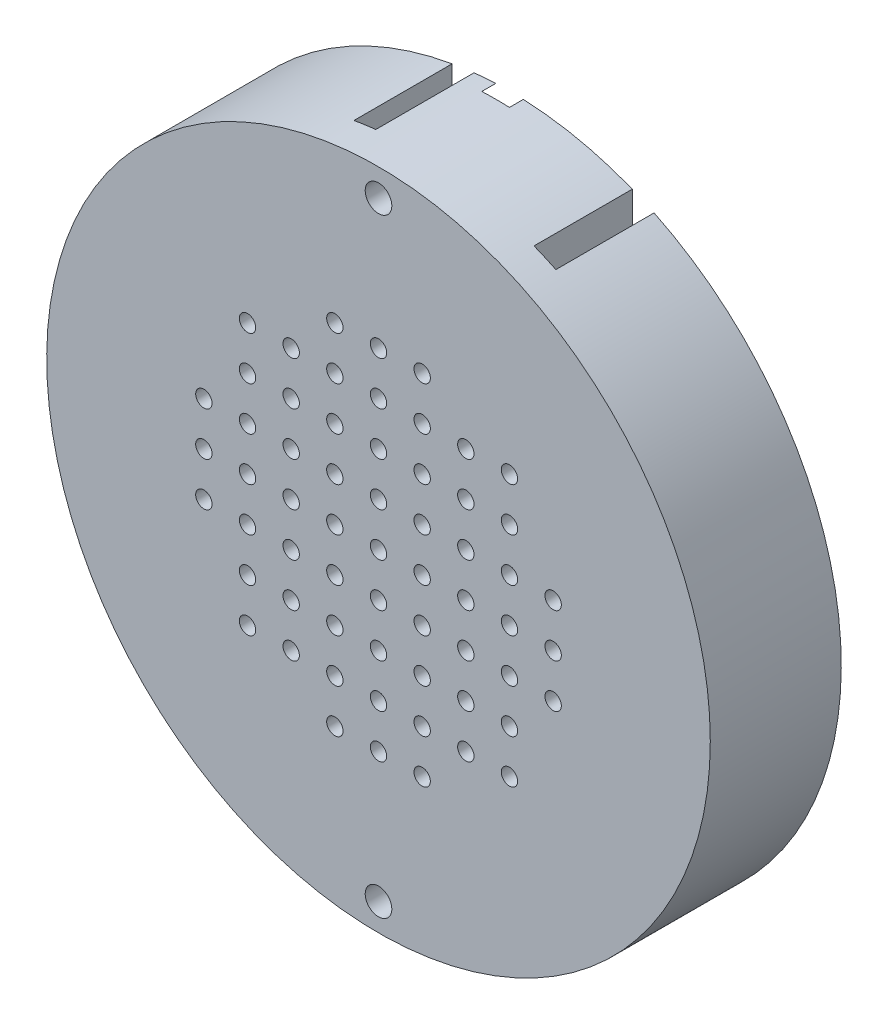
from build123d import *

# Parameters (mm, degrees)
SKETCH1_R                                           = 30.4
BOSS_EXTRUDE1_DEPTH                                 = 12
SKETCH2_R                                           = 0.75
CUT_EXTRUDE1_DEPTH                                  = 45.635411951
LPATTERN1_COUNT                                     = 5
LPATTERN1_PITCH                                     = 4
LPATTERN1_COUNT_DIR2                                = 5
LPATTERN1_PITCH_DIR2                                = 4
MIRROR1_COPY_1_SKETCH_R                             = 0.75
MIRROR1_COPY_1_DEPTH                                = 45.635411951
MIRROR1_COPY_2_SKETCH_R                             = 0.75
MIRROR1_COPY_2_DEPTH                                = 45.635411951
MIRROR1_COPY_3_SKETCH_R                             = 0.75
MIRROR1_COPY_3_DEPTH                                = 45.635411951
MIRROR1_COPY_4_SKETCH_R                             = 0.75
MIRROR1_COPY_4_DEPTH                                = 45.635411951
MIRROR1_COPY_5_SKETCH_R                             = 0.75
MIRROR1_COPY_5_DEPTH                                = 45.635411951
MIRROR1_COPY_6_SKETCH_R                             = 0.75
MIRROR1_COPY_6_DEPTH                                = 45.635411951
MIRROR1_COPY_7_SKETCH_R                             = 0.75
MIRROR1_COPY_7_DEPTH                                = 45.635411951
MIRROR1_COPY_8_SKETCH_R                             = 0.75
MIRROR1_COPY_8_DEPTH                                = 45.635411951
MIRROR1_COPY_9_SKETCH_R                             = 0.75
MIRROR1_COPY_9_DEPTH                                = 45.635411951
MIRROR1_COPY_10_SKETCH_R                            = 0.75
MIRROR1_COPY_10_DEPTH                               = 45.635411951
MIRROR1_COPY_11_SKETCH_R                            = 0.75
MIRROR1_COPY_11_DEPTH                               = 45.635411951
MIRROR1_COPY_12_SKETCH_R                            = 0.75
MIRROR1_COPY_12_DEPTH                               = 45.635411951
MIRROR1_COPY_13_SKETCH_R                            = 0.75
MIRROR1_COPY_13_DEPTH                               = 45.635411951
MIRROR1_COPY_14_SKETCH_R                            = 0.75
MIRROR1_COPY_14_DEPTH                               = 45.635411951
MIRROR1_COPY_15_SKETCH_R                            = 0.75
MIRROR1_COPY_15_DEPTH                               = 45.635411951
MIRROR1_COPY_16_SKETCH_R                            = 0.75
MIRROR1_COPY_16_DEPTH                               = 45.635411951
MIRROR1_COPY_17_SKETCH_R                            = 0.75
MIRROR1_COPY_17_DEPTH                               = 45.635411951
MIRROR1_COPY_18_SKETCH_R                            = 0.75
MIRROR1_COPY_18_DEPTH                               = 45.635411951
MIRROR1_COPY_19_SKETCH_R                            = 0.75
MIRROR1_COPY_19_DEPTH                               = 45.635411951
MIRROR1_COPY_20_SKETCH_R                            = 0.75
MIRROR1_COPY_20_DEPTH                               = 45.635411951
MIRROR1_AT_THE_SECOND_PLANE_COPY_1_SKETC_R          = 0.75
MIRROR1_AT_THE_SECOND_PLANE_COPY_1_DEPTH            = 45.635411951
MIRROR1_AT_THE_SECOND_PLANE_COPY_2_SKETC_R          = 0.75
MIRROR1_AT_THE_SECOND_PLANE_COPY_2_DEPTH            = 45.635411951
MIRROR1_AT_THE_SECOND_PLANE_COPY_3_SKETC_R          = 0.75
MIRROR1_AT_THE_SECOND_PLANE_COPY_3_DEPTH            = 45.635411951
MIRROR1_AT_THE_SECOND_PLANE_COPY_4_SKETC_R          = 0.75
MIRROR1_AT_THE_SECOND_PLANE_COPY_4_DEPTH            = 45.635411951
MIRROR1_AT_THE_SECOND_PLANE_COPY_5_SKETC_R          = 0.75
MIRROR1_AT_THE_SECOND_PLANE_COPY_5_DEPTH            = 45.635411951
MIRROR1_AT_THE_SECOND_PLANE_COPY_6_SKETC_R          = 0.75
MIRROR1_AT_THE_SECOND_PLANE_COPY_6_DEPTH            = 45.635411951
MIRROR1_AT_THE_SECOND_PLANE_COPY_7_SKETC_R          = 0.75
MIRROR1_AT_THE_SECOND_PLANE_COPY_7_DEPTH            = 45.635411951
MIRROR1_AT_THE_SECOND_PLANE_COPY_8_SKETC_R          = 0.75
MIRROR1_AT_THE_SECOND_PLANE_COPY_8_DEPTH            = 45.635411951
MIRROR1_AT_THE_SECOND_PLANE_COPY_9_SKETC_R          = 0.75
MIRROR1_AT_THE_SECOND_PLANE_COPY_9_DEPTH            = 45.635411951
MIRROR1_AT_THE_SECOND_PLANE_COPY_10_SKET_R          = 0.75
MIRROR1_AT_THE_SECOND_PLANE_COPY_10_DEPTH           = 45.635411951
MIRROR1_AT_THE_SECOND_PLANE_COPY_11_SKET_R          = 0.75
MIRROR1_AT_THE_SECOND_PLANE_COPY_11_DEPTH           = 45.635411951
MIRROR1_AT_THE_SECOND_PLANE_COPY_12_SKET_R          = 0.75
MIRROR1_AT_THE_SECOND_PLANE_COPY_12_DEPTH           = 45.635411951
MIRROR1_AT_THE_SECOND_PLANE_COPY_13_SKET_R          = 0.75
MIRROR1_AT_THE_SECOND_PLANE_COPY_13_DEPTH           = 45.635411951
MIRROR1_AT_THE_SECOND_PLANE_COPY_14_SKET_R          = 0.75
MIRROR1_AT_THE_SECOND_PLANE_COPY_14_DEPTH           = 45.635411951
MIRROR1_AT_THE_SECOND_PLANE_COPY_15_SKET_R          = 0.75
MIRROR1_AT_THE_SECOND_PLANE_COPY_15_DEPTH           = 45.635411951
MIRROR1_AT_THE_SECOND_PLANE_COPY_16_SKET_R          = 0.75
MIRROR1_AT_THE_SECOND_PLANE_COPY_16_DEPTH           = 45.635411951
MIRROR1_AT_THE_SECOND_PLANE_COPY_17_SKET_R          = 0.75
MIRROR1_AT_THE_SECOND_PLANE_COPY_17_DEPTH           = 45.635411951
MIRROR1_AT_THE_SECOND_PLANE_COPY_18_SKET_R          = 0.75
MIRROR1_AT_THE_SECOND_PLANE_COPY_18_DEPTH           = 45.635411951
MIRROR1_AT_THE_SECOND_PLANE_COPY_19_SKET_R          = 0.75
MIRROR1_AT_THE_SECOND_PLANE_COPY_19_DEPTH           = 45.635411951
MIRROR1_AT_THE_SECOND_PLANE_COPY_20_SKET_R          = 0.75
MIRROR1_AT_THE_SECOND_PLANE_COPY_20_DEPTH           = 45.635411951
MIRROR1_AT_THE_SECOND_PLANE_COPY_21_SKET_R          = 0.75
MIRROR1_AT_THE_SECOND_PLANE_COPY_21_DEPTH           = 45.635411951
MIRROR1_AT_THE_SECOND_PLANE_COPY_22_SKET_R          = 0.75
MIRROR1_AT_THE_SECOND_PLANE_COPY_22_DEPTH           = 45.635411951
MIRROR1_AT_THE_SECOND_PLANE_COPY_23_SKET_R          = 0.75
MIRROR1_AT_THE_SECOND_PLANE_COPY_23_DEPTH           = 45.635411951
MIRROR1_AT_THE_SECOND_PLANE_COPY_24_SKET_R          = 0.75
MIRROR1_AT_THE_SECOND_PLANE_COPY_24_DEPTH           = 45.635411951
MIRROR1_AT_THE_SECOND_PLANE_COPY_25_SKET_R          = 0.75
MIRROR1_AT_THE_SECOND_PLANE_COPY_25_DEPTH           = 45.635411951
MIRROR1_AT_THE_SECOND_PLANE_COPY_26_SKET_R          = 0.75
MIRROR1_AT_THE_SECOND_PLANE_COPY_26_DEPTH           = 45.635411951
MIRROR1_AT_THE_SECOND_PLANE_COPY_27_SKET_R          = 0.75
MIRROR1_AT_THE_SECOND_PLANE_COPY_27_DEPTH           = 45.635411951
MIRROR1_AT_THE_SECOND_PLANE_COPY_28_SKET_R          = 0.75
MIRROR1_AT_THE_SECOND_PLANE_COPY_28_DEPTH           = 45.635411951
MIRROR1_AT_THE_SECOND_PLANE_COPY_29_SKET_R          = 0.75
MIRROR1_AT_THE_SECOND_PLANE_COPY_29_DEPTH           = 45.635411951
MIRROR1_AT_THE_SECOND_PLANE_COPY_30_SKET_R          = 0.75
MIRROR1_AT_THE_SECOND_PLANE_COPY_30_DEPTH           = 45.635411951
MIRROR1_AT_THE_SECOND_PLANE_COPY_31_SKET_R          = 0.75
MIRROR1_AT_THE_SECOND_PLANE_COPY_31_DEPTH           = 45.635411951
MIRROR1_AT_THE_SECOND_PLANE_COPY_32_SKET_R          = 0.75
MIRROR1_AT_THE_SECOND_PLANE_COPY_32_DEPTH           = 45.635411951
MIRROR1_AT_THE_SECOND_PLANE_COPY_33_SKET_R          = 0.75
MIRROR1_AT_THE_SECOND_PLANE_COPY_33_DEPTH           = 45.635411951
MIRROR1_AT_THE_SECOND_PLANE_COPY_34_SKET_R          = 0.75
MIRROR1_AT_THE_SECOND_PLANE_COPY_34_DEPTH           = 45.635411951
MIRROR1_AT_THE_SECOND_PLANE_COPY_35_SKET_R          = 0.75
MIRROR1_AT_THE_SECOND_PLANE_COPY_35_DEPTH           = 45.635411951
MIRROR1_AT_THE_SECOND_PLANE_COPY_36_SKET_R          = 0.75
MIRROR1_AT_THE_SECOND_PLANE_COPY_36_DEPTH           = 45.635411951
MIRROR1_AT_THE_SECOND_PLANE_COPY_37_SKET_R          = 0.75
MIRROR1_AT_THE_SECOND_PLANE_COPY_37_DEPTH           = 45.635411951
MIRROR1_AT_THE_SECOND_PLANE_COPY_38_SKET_R          = 0.75
MIRROR1_AT_THE_SECOND_PLANE_COPY_38_DEPTH           = 45.635411951
MIRROR1_AT_THE_SECOND_PLANE_COPY_39_SKET_R          = 0.75
MIRROR1_AT_THE_SECOND_PLANE_COPY_39_DEPTH           = 45.635411951
MIRROR1_AT_THE_SECOND_PLANE_COPY_40_SKET_R          = 0.75
MIRROR1_AT_THE_SECOND_PLANE_COPY_40_DEPTH           = 45.635411951
MIRROR1_AT_THE_SECOND_PLANE_COPY_41_SKET_R          = 0.75
MIRROR1_AT_THE_SECOND_PLANE_COPY_41_DEPTH           = 45.635411951
SKETCH3_W                                           = 2
SKETCH3_H                                           = 40.991768712
SKETCH3_H_2                                         = 46.975775424
CUT_EXTRUDE2_DEPTH                                  = 9
SKETCH4_W                                           = 3.5
SKETCH4_H                                           = 1.5
CUT_EXTRUDE3_DEPTH                                  = 4
SKETCH5_W                                           = 4
SKETCH5_H                                           = 1.5
SKETCH5_W_2                                         = 3.5
CUT_EXTRUDE7_DEPTH                                  = 4
CBORE_FOR_2_BINDING_HEAD_MACHINE_SCREW2_D           = 2.4384
CBORE_FOR_2_BINDING_HEAD_MACHINE_SCREW2_CBORE_D     = 5.55752
CBORE_FOR_2_BINDING_HEAD_MACHINE_SCREW2_CBORE_DEPTH = 1.27


# Read off the part's stored shape, not the designer's step: AdvancedHole1
with BuildPart() as part:
    # Sketch1 → Boss-Extrude1 (new body)
    with BuildSketch(Plane.XY):
        Circle(SKETCH1_R)
    extrude(amount=BOSS_EXTRUDE1_DEPTH)

    # Sketch2 → Cut-Extrude1 (cut, through all)
    with BuildSketch(Plane.XY.offset(12)):
        Circle(SKETCH2_R)
    cut_extrude1 = extrude(amount=-CUT_EXTRUDE1_DEPTH, mode=Mode.SUBTRACT)

    # LPattern1: Cut-Extrude1 5 × 5, 5 skipped
    with Locations(*[(j * LPATTERN1_PITCH_DIR2, i * LPATTERN1_PITCH, 0) for i in range(LPATTERN1_COUNT) for j in range(LPATTERN1_COUNT_DIR2) if (i, j) not in ((0, 0), (2, 4), (3, 4), (4, 2), (4, 3), (4, 4))]):
        add(cut_extrude1, mode=Mode.SUBTRACT)

    # Mirror1 copy 1 sketch → Mirror1 copy 1 (cut, through all)
    with BuildSketch(Plane(origin=(-4, 0, 12), x_dir=(-1, 0, 0), z_dir=(0, 0, 1))):
        Circle(MIRROR1_COPY_1_SKETCH_R)
    extrude(amount=-MIRROR1_COPY_1_DEPTH, mode=Mode.SUBTRACT)

    # Mirror1 copy 2 sketch → Mirror1 copy 2 (cut, through all)
    with BuildSketch(Plane(origin=(-8, 0, 12), x_dir=(-1, 0, 0), z_dir=(0, 0, 1))):
        Circle(MIRROR1_COPY_2_SKETCH_R)
    extrude(amount=-MIRROR1_COPY_2_DEPTH, mode=Mode.SUBTRACT)

    # Mirror1 copy 3 sketch → Mirror1 copy 3 (cut, through all)
    with BuildSketch(Plane(origin=(-12, 0, 12), x_dir=(-1, 0, 0), z_dir=(0, 0, 1))):
        Circle(MIRROR1_COPY_3_SKETCH_R)
    extrude(amount=-MIRROR1_COPY_3_DEPTH, mode=Mode.SUBTRACT)

    # Mirror1 copy 4 sketch → Mirror1 copy 4 (cut, through all)
    with BuildSketch(Plane(origin=(-16, 0, 12), x_dir=(-1, 0, 0), z_dir=(0, 0, 1))):
        Circle(MIRROR1_COPY_4_SKETCH_R)
    extrude(amount=-MIRROR1_COPY_4_DEPTH, mode=Mode.SUBTRACT)

    # Mirror1 copy 5 sketch → Mirror1 copy 5 (cut, through all)
    with BuildSketch(Plane(origin=(0, 4, 12), x_dir=(-1, 0, 0), z_dir=(0, 0, 1))):
        Circle(MIRROR1_COPY_5_SKETCH_R)
    extrude(amount=-MIRROR1_COPY_5_DEPTH, mode=Mode.SUBTRACT)

    # Mirror1 copy 6 sketch → Mirror1 copy 6 (cut, through all)
    with BuildSketch(Plane(origin=(-4, 4, 12), x_dir=(-1, 0, 0), z_dir=(0, 0, 1))):
        Circle(MIRROR1_COPY_6_SKETCH_R)
    extrude(amount=-MIRROR1_COPY_6_DEPTH, mode=Mode.SUBTRACT)

    # Mirror1 copy 7 sketch → Mirror1 copy 7 (cut, through all)
    with BuildSketch(Plane(origin=(-8, 4, 12), x_dir=(-1, 0, 0), z_dir=(0, 0, 1))):
        Circle(MIRROR1_COPY_7_SKETCH_R)
    extrude(amount=-MIRROR1_COPY_7_DEPTH, mode=Mode.SUBTRACT)

    # Mirror1 copy 8 sketch → Mirror1 copy 8 (cut, through all)
    with BuildSketch(Plane(origin=(-12, 4, 12), x_dir=(-1, 0, 0), z_dir=(0, 0, 1))):
        Circle(MIRROR1_COPY_8_SKETCH_R)
    extrude(amount=-MIRROR1_COPY_8_DEPTH, mode=Mode.SUBTRACT)

    # Mirror1 copy 9 sketch → Mirror1 copy 9 (cut, through all)
    with BuildSketch(Plane(origin=(-16, 4, 12), x_dir=(-1, 0, 0), z_dir=(0, 0, 1))):
        Circle(MIRROR1_COPY_9_SKETCH_R)
    extrude(amount=-MIRROR1_COPY_9_DEPTH, mode=Mode.SUBTRACT)

    # Mirror1 copy 10 sketch → Mirror1 copy 10 (cut, through all)
    with BuildSketch(Plane(origin=(0, 8, 12), x_dir=(-1, 0, 0), z_dir=(0, 0, 1))):
        Circle(MIRROR1_COPY_10_SKETCH_R)
    extrude(amount=-MIRROR1_COPY_10_DEPTH, mode=Mode.SUBTRACT)

    # Mirror1 copy 11 sketch → Mirror1 copy 11 (cut, through all)
    with BuildSketch(Plane(origin=(-4, 8, 12), x_dir=(-1, 0, 0), z_dir=(0, 0, 1))):
        Circle(MIRROR1_COPY_11_SKETCH_R)
    extrude(amount=-MIRROR1_COPY_11_DEPTH, mode=Mode.SUBTRACT)

    # Mirror1 copy 12 sketch → Mirror1 copy 12 (cut, through all)
    with BuildSketch(Plane(origin=(-8, 8, 12), x_dir=(-1, 0, 0), z_dir=(0, 0, 1))):
        Circle(MIRROR1_COPY_12_SKETCH_R)
    extrude(amount=-MIRROR1_COPY_12_DEPTH, mode=Mode.SUBTRACT)

    # Mirror1 copy 13 sketch → Mirror1 copy 13 (cut, through all)
    with BuildSketch(Plane(origin=(-12, 8, 12), x_dir=(-1, 0, 0), z_dir=(0, 0, 1))):
        Circle(MIRROR1_COPY_13_SKETCH_R)
    extrude(amount=-MIRROR1_COPY_13_DEPTH, mode=Mode.SUBTRACT)

    # Mirror1 copy 14 sketch → Mirror1 copy 14 (cut, through all)
    with BuildSketch(Plane(origin=(0, 12, 12), x_dir=(-1, 0, 0), z_dir=(0, 0, 1))):
        Circle(MIRROR1_COPY_14_SKETCH_R)
    extrude(amount=-MIRROR1_COPY_14_DEPTH, mode=Mode.SUBTRACT)

    # Mirror1 copy 15 sketch → Mirror1 copy 15 (cut, through all)
    with BuildSketch(Plane(origin=(-4, 12, 12), x_dir=(-1, 0, 0), z_dir=(0, 0, 1))):
        Circle(MIRROR1_COPY_15_SKETCH_R)
    extrude(amount=-MIRROR1_COPY_15_DEPTH, mode=Mode.SUBTRACT)

    # Mirror1 copy 16 sketch → Mirror1 copy 16 (cut, through all)
    with BuildSketch(Plane(origin=(-8, 12, 12), x_dir=(-1, 0, 0), z_dir=(0, 0, 1))):
        Circle(MIRROR1_COPY_16_SKETCH_R)
    extrude(amount=-MIRROR1_COPY_16_DEPTH, mode=Mode.SUBTRACT)

    # Mirror1 copy 17 sketch → Mirror1 copy 17 (cut, through all)
    with BuildSketch(Plane(origin=(-12, 12, 12), x_dir=(-1, 0, 0), z_dir=(0, 0, 1))):
        Circle(MIRROR1_COPY_17_SKETCH_R)
    extrude(amount=-MIRROR1_COPY_17_DEPTH, mode=Mode.SUBTRACT)

    # Mirror1 copy 18 sketch → Mirror1 copy 18 (cut, through all)
    with BuildSketch(Plane(origin=(0, 16, 12), x_dir=(-1, 0, 0), z_dir=(0, 0, 1))):
        Circle(MIRROR1_COPY_18_SKETCH_R)
    extrude(amount=-MIRROR1_COPY_18_DEPTH, mode=Mode.SUBTRACT)

    # Mirror1 copy 19 sketch → Mirror1 copy 19 (cut, through all)
    with BuildSketch(Plane(origin=(-4, 16, 12), x_dir=(-1, 0, 0), z_dir=(0, 0, 1))):
        Circle(MIRROR1_COPY_19_SKETCH_R)
    extrude(amount=-MIRROR1_COPY_19_DEPTH, mode=Mode.SUBTRACT)

    # Mirror1 copy 20 sketch → Mirror1 copy 20 (cut, through all)
    with BuildSketch(Plane(origin=(0, 0, 12), x_dir=(-1, 0, 0), z_dir=(0, 0, 1))):
        Circle(MIRROR1_COPY_20_SKETCH_R)
    extrude(amount=-MIRROR1_COPY_20_DEPTH, mode=Mode.SUBTRACT)

    # Mirror1 at the second plane copy 1 sketc → Mirror1 at the second plane copy 1 (cut, through all)
    with BuildSketch(Plane(origin=(4, 0, 12), x_dir=(1, 0, 0), z_dir=(0, 0, 1))):
        Circle(MIRROR1_AT_THE_SECOND_PLANE_COPY_1_SKETC_R)
    extrude(amount=-MIRROR1_AT_THE_SECOND_PLANE_COPY_1_DEPTH, mode=Mode.SUBTRACT)

    # Mirror1 at the second plane copy 2 sketc → Mirror1 at the second plane copy 2 (cut, through all)
    with BuildSketch(Plane(origin=(8, 0, 12), x_dir=(1, 0, 0), z_dir=(0, 0, 1))):
        Circle(MIRROR1_AT_THE_SECOND_PLANE_COPY_2_SKETC_R)
    extrude(amount=-MIRROR1_AT_THE_SECOND_PLANE_COPY_2_DEPTH, mode=Mode.SUBTRACT)

    # Mirror1 at the second plane copy 3 sketc → Mirror1 at the second plane copy 3 (cut, through all)
    with BuildSketch(Plane(origin=(12, 0, 12), x_dir=(1, 0, 0), z_dir=(0, 0, 1))):
        Circle(MIRROR1_AT_THE_SECOND_PLANE_COPY_3_SKETC_R)
    extrude(amount=-MIRROR1_AT_THE_SECOND_PLANE_COPY_3_DEPTH, mode=Mode.SUBTRACT)

    # Mirror1 at the second plane copy 4 sketc → Mirror1 at the second plane copy 4 (cut, through all)
    with BuildSketch(Plane(origin=(16, 0, 12), x_dir=(1, 0, 0), z_dir=(0, 0, 1))):
        Circle(MIRROR1_AT_THE_SECOND_PLANE_COPY_4_SKETC_R)
    extrude(amount=-MIRROR1_AT_THE_SECOND_PLANE_COPY_4_DEPTH, mode=Mode.SUBTRACT)

    # Mirror1 at the second plane copy 5 sketc → Mirror1 at the second plane copy 5 (cut, through all)
    with BuildSketch(Plane(origin=(0, -4, 12), x_dir=(1, 0, 0), z_dir=(0, 0, 1))):
        Circle(MIRROR1_AT_THE_SECOND_PLANE_COPY_5_SKETC_R)
    extrude(amount=-MIRROR1_AT_THE_SECOND_PLANE_COPY_5_DEPTH, mode=Mode.SUBTRACT)

    # Mirror1 at the second plane copy 6 sketc → Mirror1 at the second plane copy 6 (cut, through all)
    with BuildSketch(Plane(origin=(4, -4, 12), x_dir=(1, 0, 0), z_dir=(0, 0, 1))):
        Circle(MIRROR1_AT_THE_SECOND_PLANE_COPY_6_SKETC_R)
    extrude(amount=-MIRROR1_AT_THE_SECOND_PLANE_COPY_6_DEPTH, mode=Mode.SUBTRACT)

    # Mirror1 at the second plane copy 7 sketc → Mirror1 at the second plane copy 7 (cut, through all)
    with BuildSketch(Plane(origin=(8, -4, 12), x_dir=(1, 0, 0), z_dir=(0, 0, 1))):
        Circle(MIRROR1_AT_THE_SECOND_PLANE_COPY_7_SKETC_R)
    extrude(amount=-MIRROR1_AT_THE_SECOND_PLANE_COPY_7_DEPTH, mode=Mode.SUBTRACT)

    # Mirror1 at the second plane copy 8 sketc → Mirror1 at the second plane copy 8 (cut, through all)
    with BuildSketch(Plane(origin=(12, -4, 12), x_dir=(1, 0, 0), z_dir=(0, 0, 1))):
        Circle(MIRROR1_AT_THE_SECOND_PLANE_COPY_8_SKETC_R)
    extrude(amount=-MIRROR1_AT_THE_SECOND_PLANE_COPY_8_DEPTH, mode=Mode.SUBTRACT)

    # Mirror1 at the second plane copy 9 sketc → Mirror1 at the second plane copy 9 (cut, through all)
    with BuildSketch(Plane(origin=(16, -4, 12), x_dir=(1, 0, 0), z_dir=(0, 0, 1))):
        Circle(MIRROR1_AT_THE_SECOND_PLANE_COPY_9_SKETC_R)
    extrude(amount=-MIRROR1_AT_THE_SECOND_PLANE_COPY_9_DEPTH, mode=Mode.SUBTRACT)

    # Mirror1 at the second plane copy 10 sket → Mirror1 at the second plane copy 10 (cut, through all)
    with BuildSketch(Plane(origin=(0, -8, 12), x_dir=(1, 0, 0), z_dir=(0, 0, 1))):
        Circle(MIRROR1_AT_THE_SECOND_PLANE_COPY_10_SKET_R)
    extrude(amount=-MIRROR1_AT_THE_SECOND_PLANE_COPY_10_DEPTH, mode=Mode.SUBTRACT)

    # Mirror1 at the second plane copy 11 sket → Mirror1 at the second plane copy 11 (cut, through all)
    with BuildSketch(Plane(origin=(4, -8, 12), x_dir=(1, 0, 0), z_dir=(0, 0, 1))):
        Circle(MIRROR1_AT_THE_SECOND_PLANE_COPY_11_SKET_R)
    extrude(amount=-MIRROR1_AT_THE_SECOND_PLANE_COPY_11_DEPTH, mode=Mode.SUBTRACT)

    # Mirror1 at the second plane copy 12 sket → Mirror1 at the second plane copy 12 (cut, through all)
    with BuildSketch(Plane(origin=(8, -8, 12), x_dir=(1, 0, 0), z_dir=(0, 0, 1))):
        Circle(MIRROR1_AT_THE_SECOND_PLANE_COPY_12_SKET_R)
    extrude(amount=-MIRROR1_AT_THE_SECOND_PLANE_COPY_12_DEPTH, mode=Mode.SUBTRACT)

    # Mirror1 at the second plane copy 13 sket → Mirror1 at the second plane copy 13 (cut, through all)
    with BuildSketch(Plane(origin=(12, -8, 12), x_dir=(1, 0, 0), z_dir=(0, 0, 1))):
        Circle(MIRROR1_AT_THE_SECOND_PLANE_COPY_13_SKET_R)
    extrude(amount=-MIRROR1_AT_THE_SECOND_PLANE_COPY_13_DEPTH, mode=Mode.SUBTRACT)

    # Mirror1 at the second plane copy 14 sket → Mirror1 at the second plane copy 14 (cut, through all)
    with BuildSketch(Plane(origin=(0, -12, 12), x_dir=(1, 0, 0), z_dir=(0, 0, 1))):
        Circle(MIRROR1_AT_THE_SECOND_PLANE_COPY_14_SKET_R)
    extrude(amount=-MIRROR1_AT_THE_SECOND_PLANE_COPY_14_DEPTH, mode=Mode.SUBTRACT)

    # Mirror1 at the second plane copy 15 sket → Mirror1 at the second plane copy 15 (cut, through all)
    with BuildSketch(Plane(origin=(4, -12, 12), x_dir=(1, 0, 0), z_dir=(0, 0, 1))):
        Circle(MIRROR1_AT_THE_SECOND_PLANE_COPY_15_SKET_R)
    extrude(amount=-MIRROR1_AT_THE_SECOND_PLANE_COPY_15_DEPTH, mode=Mode.SUBTRACT)

    # Mirror1 at the second plane copy 16 sket → Mirror1 at the second plane copy 16 (cut, through all)
    with BuildSketch(Plane(origin=(8, -12, 12), x_dir=(1, 0, 0), z_dir=(0, 0, 1))):
        Circle(MIRROR1_AT_THE_SECOND_PLANE_COPY_16_SKET_R)
    extrude(amount=-MIRROR1_AT_THE_SECOND_PLANE_COPY_16_DEPTH, mode=Mode.SUBTRACT)

    # Mirror1 at the second plane copy 17 sket → Mirror1 at the second plane copy 17 (cut, through all)
    with BuildSketch(Plane(origin=(12, -12, 12), x_dir=(1, 0, 0), z_dir=(0, 0, 1))):
        Circle(MIRROR1_AT_THE_SECOND_PLANE_COPY_17_SKET_R)
    extrude(amount=-MIRROR1_AT_THE_SECOND_PLANE_COPY_17_DEPTH, mode=Mode.SUBTRACT)

    # Mirror1 at the second plane copy 18 sket → Mirror1 at the second plane copy 18 (cut, through all)
    with BuildSketch(Plane(origin=(0, -16, 12), x_dir=(1, 0, 0), z_dir=(0, 0, 1))):
        Circle(MIRROR1_AT_THE_SECOND_PLANE_COPY_18_SKET_R)
    extrude(amount=-MIRROR1_AT_THE_SECOND_PLANE_COPY_18_DEPTH, mode=Mode.SUBTRACT)

    # Mirror1 at the second plane copy 19 sket → Mirror1 at the second plane copy 19 (cut, through all)
    with BuildSketch(Plane(origin=(4, -16, 12), x_dir=(1, 0, 0), z_dir=(0, 0, 1))):
        Circle(MIRROR1_AT_THE_SECOND_PLANE_COPY_19_SKET_R)
    extrude(amount=-MIRROR1_AT_THE_SECOND_PLANE_COPY_19_DEPTH, mode=Mode.SUBTRACT)

    # Mirror1 at the second plane copy 20 sket → Mirror1 at the second plane copy 20 (cut, through all)
    with BuildSketch(Plane.XY.offset(12)):
        Circle(MIRROR1_AT_THE_SECOND_PLANE_COPY_20_SKET_R)
    extrude(amount=-MIRROR1_AT_THE_SECOND_PLANE_COPY_20_DEPTH, mode=Mode.SUBTRACT)

    # Mirror1 at the second plane copy 21 sket → Mirror1 at the second plane copy 21 (cut, through all)
    with BuildSketch(Plane(origin=(-4, 0, 12), x_dir=(-1, 0, 0), z_dir=(0, 0, 1))):
        Circle(MIRROR1_AT_THE_SECOND_PLANE_COPY_21_SKET_R)
    extrude(amount=-MIRROR1_AT_THE_SECOND_PLANE_COPY_21_DEPTH, mode=Mode.SUBTRACT)

    # Mirror1 at the second plane copy 22 sket → Mirror1 at the second plane copy 22 (cut, through all)
    with BuildSketch(Plane(origin=(-8, 0, 12), x_dir=(-1, 0, 0), z_dir=(0, 0, 1))):
        Circle(MIRROR1_AT_THE_SECOND_PLANE_COPY_22_SKET_R)
    extrude(amount=-MIRROR1_AT_THE_SECOND_PLANE_COPY_22_DEPTH, mode=Mode.SUBTRACT)

    # Mirror1 at the second plane copy 23 sket → Mirror1 at the second plane copy 23 (cut, through all)
    with BuildSketch(Plane(origin=(-12, 0, 12), x_dir=(-1, 0, 0), z_dir=(0, 0, 1))):
        Circle(MIRROR1_AT_THE_SECOND_PLANE_COPY_23_SKET_R)
    extrude(amount=-MIRROR1_AT_THE_SECOND_PLANE_COPY_23_DEPTH, mode=Mode.SUBTRACT)

    # Mirror1 at the second plane copy 24 sket → Mirror1 at the second plane copy 24 (cut, through all)
    with BuildSketch(Plane(origin=(-16, 0, 12), x_dir=(-1, 0, 0), z_dir=(0, 0, 1))):
        Circle(MIRROR1_AT_THE_SECOND_PLANE_COPY_24_SKET_R)
    extrude(amount=-MIRROR1_AT_THE_SECOND_PLANE_COPY_24_DEPTH, mode=Mode.SUBTRACT)

    # Mirror1 at the second plane copy 25 sket → Mirror1 at the second plane copy 25 (cut, through all)
    with BuildSketch(Plane(origin=(0, -4, 12), x_dir=(-1, 0, 0), z_dir=(0, 0, 1))):
        Circle(MIRROR1_AT_THE_SECOND_PLANE_COPY_25_SKET_R)
    extrude(amount=-MIRROR1_AT_THE_SECOND_PLANE_COPY_25_DEPTH, mode=Mode.SUBTRACT)

    # Mirror1 at the second plane copy 26 sket → Mirror1 at the second plane copy 26 (cut, through all)
    with BuildSketch(Plane(origin=(-4, -4, 12), x_dir=(-1, 0, 0), z_dir=(0, 0, 1))):
        Circle(MIRROR1_AT_THE_SECOND_PLANE_COPY_26_SKET_R)
    extrude(amount=-MIRROR1_AT_THE_SECOND_PLANE_COPY_26_DEPTH, mode=Mode.SUBTRACT)

    # Mirror1 at the second plane copy 27 sket → Mirror1 at the second plane copy 27 (cut, through all)
    with BuildSketch(Plane(origin=(-8, -4, 12), x_dir=(-1, 0, 0), z_dir=(0, 0, 1))):
        Circle(MIRROR1_AT_THE_SECOND_PLANE_COPY_27_SKET_R)
    extrude(amount=-MIRROR1_AT_THE_SECOND_PLANE_COPY_27_DEPTH, mode=Mode.SUBTRACT)

    # Mirror1 at the second plane copy 28 sket → Mirror1 at the second plane copy 28 (cut, through all)
    with BuildSketch(Plane(origin=(-12, -4, 12), x_dir=(-1, 0, 0), z_dir=(0, 0, 1))):
        Circle(MIRROR1_AT_THE_SECOND_PLANE_COPY_28_SKET_R)
    extrude(amount=-MIRROR1_AT_THE_SECOND_PLANE_COPY_28_DEPTH, mode=Mode.SUBTRACT)

    # Mirror1 at the second plane copy 29 sket → Mirror1 at the second plane copy 29 (cut, through all)
    with BuildSketch(Plane(origin=(-16, -4, 12), x_dir=(-1, 0, 0), z_dir=(0, 0, 1))):
        Circle(MIRROR1_AT_THE_SECOND_PLANE_COPY_29_SKET_R)
    extrude(amount=-MIRROR1_AT_THE_SECOND_PLANE_COPY_29_DEPTH, mode=Mode.SUBTRACT)

    # Mirror1 at the second plane copy 30 sket → Mirror1 at the second plane copy 30 (cut, through all)
    with BuildSketch(Plane(origin=(0, -8, 12), x_dir=(-1, 0, 0), z_dir=(0, 0, 1))):
        Circle(MIRROR1_AT_THE_SECOND_PLANE_COPY_30_SKET_R)
    extrude(amount=-MIRROR1_AT_THE_SECOND_PLANE_COPY_30_DEPTH, mode=Mode.SUBTRACT)

    # Mirror1 at the second plane copy 31 sket → Mirror1 at the second plane copy 31 (cut, through all)
    with BuildSketch(Plane(origin=(-4, -8, 12), x_dir=(-1, 0, 0), z_dir=(0, 0, 1))):
        Circle(MIRROR1_AT_THE_SECOND_PLANE_COPY_31_SKET_R)
    extrude(amount=-MIRROR1_AT_THE_SECOND_PLANE_COPY_31_DEPTH, mode=Mode.SUBTRACT)

    # Mirror1 at the second plane copy 32 sket → Mirror1 at the second plane copy 32 (cut, through all)
    with BuildSketch(Plane(origin=(-8, -8, 12), x_dir=(-1, 0, 0), z_dir=(0, 0, 1))):
        Circle(MIRROR1_AT_THE_SECOND_PLANE_COPY_32_SKET_R)
    extrude(amount=-MIRROR1_AT_THE_SECOND_PLANE_COPY_32_DEPTH, mode=Mode.SUBTRACT)

    # Mirror1 at the second plane copy 33 sket → Mirror1 at the second plane copy 33 (cut, through all)
    with BuildSketch(Plane(origin=(-12, -8, 12), x_dir=(-1, 0, 0), z_dir=(0, 0, 1))):
        Circle(MIRROR1_AT_THE_SECOND_PLANE_COPY_33_SKET_R)
    extrude(amount=-MIRROR1_AT_THE_SECOND_PLANE_COPY_33_DEPTH, mode=Mode.SUBTRACT)

    # Mirror1 at the second plane copy 34 sket → Mirror1 at the second plane copy 34 (cut, through all)
    with BuildSketch(Plane(origin=(0, -12, 12), x_dir=(-1, 0, 0), z_dir=(0, 0, 1))):
        Circle(MIRROR1_AT_THE_SECOND_PLANE_COPY_34_SKET_R)
    extrude(amount=-MIRROR1_AT_THE_SECOND_PLANE_COPY_34_DEPTH, mode=Mode.SUBTRACT)

    # Mirror1 at the second plane copy 35 sket → Mirror1 at the second plane copy 35 (cut, through all)
    with BuildSketch(Plane(origin=(-4, -12, 12), x_dir=(-1, 0, 0), z_dir=(0, 0, 1))):
        Circle(MIRROR1_AT_THE_SECOND_PLANE_COPY_35_SKET_R)
    extrude(amount=-MIRROR1_AT_THE_SECOND_PLANE_COPY_35_DEPTH, mode=Mode.SUBTRACT)

    # Mirror1 at the second plane copy 36 sket → Mirror1 at the second plane copy 36 (cut, through all)
    with BuildSketch(Plane(origin=(-8, -12, 12), x_dir=(-1, 0, 0), z_dir=(0, 0, 1))):
        Circle(MIRROR1_AT_THE_SECOND_PLANE_COPY_36_SKET_R)
    extrude(amount=-MIRROR1_AT_THE_SECOND_PLANE_COPY_36_DEPTH, mode=Mode.SUBTRACT)

    # Mirror1 at the second plane copy 37 sket → Mirror1 at the second plane copy 37 (cut, through all)
    with BuildSketch(Plane(origin=(-12, -12, 12), x_dir=(-1, 0, 0), z_dir=(0, 0, 1))):
        Circle(MIRROR1_AT_THE_SECOND_PLANE_COPY_37_SKET_R)
    extrude(amount=-MIRROR1_AT_THE_SECOND_PLANE_COPY_37_DEPTH, mode=Mode.SUBTRACT)

    # Mirror1 at the second plane copy 38 sket → Mirror1 at the second plane copy 38 (cut, through all)
    with BuildSketch(Plane(origin=(0, -16, 12), x_dir=(-1, 0, 0), z_dir=(0, 0, 1))):
        Circle(MIRROR1_AT_THE_SECOND_PLANE_COPY_38_SKET_R)
    extrude(amount=-MIRROR1_AT_THE_SECOND_PLANE_COPY_38_DEPTH, mode=Mode.SUBTRACT)

    # Mirror1 at the second plane copy 39 sket → Mirror1 at the second plane copy 39 (cut, through all)
    with BuildSketch(Plane(origin=(-4, -16, 12), x_dir=(-1, 0, 0), z_dir=(0, 0, 1))):
        Circle(MIRROR1_AT_THE_SECOND_PLANE_COPY_39_SKET_R)
    extrude(amount=-MIRROR1_AT_THE_SECOND_PLANE_COPY_39_DEPTH, mode=Mode.SUBTRACT)

    # Mirror1 at the second plane copy 40 sket → Mirror1 at the second plane copy 40 (cut, through all)
    with BuildSketch(Plane(origin=(0, 0, 12), x_dir=(-1, 0, 0), z_dir=(0, 0, 1))):
        Circle(MIRROR1_AT_THE_SECOND_PLANE_COPY_40_SKET_R)
    extrude(amount=-MIRROR1_AT_THE_SECOND_PLANE_COPY_40_DEPTH, mode=Mode.SUBTRACT)

    # Mirror1 at the second plane copy 41 sket → Mirror1 at the second plane copy 41 (cut, through all)
    with BuildSketch(Plane.XY.offset(12)):
        Circle(MIRROR1_AT_THE_SECOND_PLANE_COPY_41_SKET_R)
    extrude(amount=-MIRROR1_AT_THE_SECOND_PLANE_COPY_41_DEPTH, mode=Mode.SUBTRACT)

    # Sketch3 → Cut-Extrude2 (cut)
    with BuildSketch(Plane(origin=(0, 0, 0), x_dir=(-1, 0, 0), z_dir=(0, 0, -1))):
        with Locations((-12.25, 7.745884356)):
            Rectangle(SKETCH3_W, SKETCH3_H)
        with Locations((-4.25, -6.737887712)):
            Rectangle(SKETCH3_W, SKETCH3_H_2)
        with Locations((4.25, 6.737887712)):
            Rectangle(SKETCH3_W, SKETCH3_H_2)
        with Locations((12.25, -7.745884356)):
            Rectangle(SKETCH3_W, SKETCH3_H)
    extrude(amount=-CUT_EXTRUDE2_DEPTH, mode=Mode.SUBTRACT)

    # Sketch4 → Cut-Extrude3 (cut)
    with BuildSketch(Plane(origin=(0, 0, 0), x_dir=(-1, 0, 0), z_dir=(0, 0, -1))):
        with Locations((15, -4)):
            Rectangle(SKETCH4_W, SKETCH4_H)
        with Locations((15, 0)):
            Rectangle(SKETCH4_W, SKETCH4_H)
        with Locations((15, 4)):
            Rectangle(SKETCH4_W, SKETCH4_H)
        with Locations((-15, -4)):
            Rectangle(SKETCH4_W, SKETCH4_H)
        with Locations((-15, 0)):
            Rectangle(SKETCH4_W, SKETCH4_H)
        with Locations((-15, 4)):
            Rectangle(SKETCH4_W, SKETCH4_H)
    extrude(amount=-CUT_EXTRUDE3_DEPTH, mode=Mode.SUBTRACT)

    # Sketch5 → Cut-Extrude7 (cut)
    with BuildSketch(Plane(origin=(0, 0, 0), x_dir=(-1, 0, 0), z_dir=(0, 0, -1))):
        with Locations((-9.25, 12)):
            Rectangle(SKETCH5_W, SKETCH5_H)
        with Locations((-9.25, 8)):
            Rectangle(SKETCH5_W, SKETCH5_H)
        with Locations((-9.25, 4)):
            Rectangle(SKETCH5_W, SKETCH5_H)
        with Locations((-9.25, 0)):
            Rectangle(SKETCH5_W, SKETCH5_H)
        with Locations((-9.25, -4)):
            Rectangle(SKETCH5_W, SKETCH5_H)
        with Locations((-9.25, -8)):
            Rectangle(SKETCH5_W, SKETCH5_H)
        with Locations((-7, -12)):
            Rectangle(SKETCH5_W_2, SKETCH5_H)
        with Locations((-1.25, -16)):
            Rectangle(SKETCH5_W, SKETCH5_H)
        with Locations((-1.25, -12)):
            Rectangle(SKETCH5_W, SKETCH5_H)
        with Locations((-1.25, -8)):
            Rectangle(SKETCH5_W, SKETCH5_H)
        with Locations((-1.25, -4)):
            Rectangle(SKETCH5_W, SKETCH5_H)
        with Locations((-1.25, 0)):
            Rectangle(SKETCH5_W, SKETCH5_H)
        with Locations((-1.25, 4)):
            Rectangle(SKETCH5_W, SKETCH5_H)
        with Locations((1.25, 8)):
            Rectangle(SKETCH5_W, SKETCH5_H)
        with Locations((1.25, 12)):
            Rectangle(SKETCH5_W, SKETCH5_H)
        with Locations((1.25, 16)):
            Rectangle(SKETCH5_W, SKETCH5_H)
        with Locations((7, 12)):
            Rectangle(SKETCH5_W_2, SKETCH5_H)
        with Locations((7, 8)):
            Rectangle(SKETCH5_W_2, SKETCH5_H)
        with Locations((7, 4)):
            Rectangle(SKETCH5_W_2, SKETCH5_H)
        with Locations((7, 0)):
            Rectangle(SKETCH5_W_2, SKETCH5_H)
        with Locations((9.25, -4)):
            Rectangle(SKETCH5_W, SKETCH5_H)
        with Locations((9.25, -8)):
            Rectangle(SKETCH5_W, SKETCH5_H)
        with Locations((9.25, -12)):
            Rectangle(SKETCH5_W, SKETCH5_H)
    extrude(amount=-CUT_EXTRUDE7_DEPTH, mode=Mode.SUBTRACT)

    # CBORE for #2 Binding Head Machine Screw2 (through all)
    with Locations(Plane(origin=(0, 0, 0), x_dir=(-1, 0, 0), z_dir=(0, 0, -1))):
        with Locations((0, 27.9)):
            cbore_for_2_binding_head_machine_screw2 = CounterBoreHole(CBORE_FOR_2_BINDING_HEAD_MACHINE_SCREW2_D / 2, CBORE_FOR_2_BINDING_HEAD_MACHINE_SCREW2_CBORE_D / 2, CBORE_FOR_2_BINDING_HEAD_MACHINE_SCREW2_CBORE_DEPTH)

    # AdvancedHole1 outline → AdvancedHole1 (revolve, cut)
    with BuildSketch(Plane(origin=(26.4, 0, 0), x_dir=(1, 0, 0), z_dir=(0, -1, 0))):
        Polygon((1.2192, 0), (1.2192, 6.35), (0, 7.082569267), (0, 0), align=None)
    advancedhole1 = revolve(axis=Axis((26.4, 0, 0), (0, 0, 1)), mode=Mode.SUBTRACT)

    # Mirror2: AdvancedHole1 across plane
    add(advancedhole1.mirror(Plane(origin=(0, 0, 0), x_dir=(0, 0, 1), z_dir=(1, 0, 0))), mode=Mode.SUBTRACT)

    # Mirror3: CBORE for #2 Binding Head Machine Screw2 across plane
    add(cbore_for_2_binding_head_machine_screw2.mirror(Plane.ZX), mode=Mode.SUBTRACT)


solid = part.part
